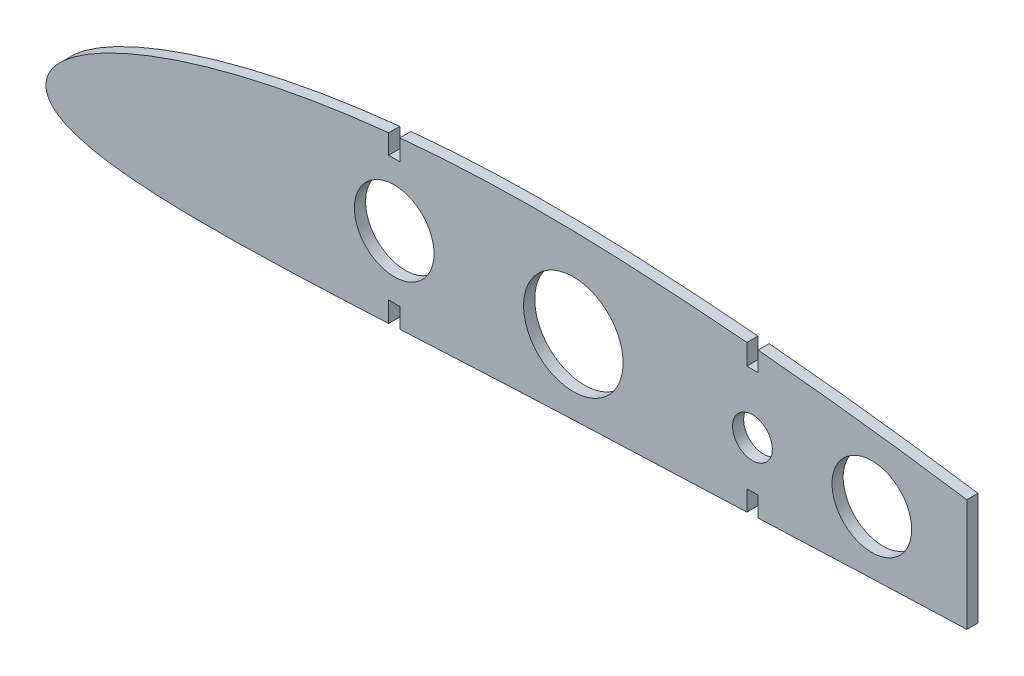
from build123d import *

# Parameters (mm, degrees)
SKETCH_2_R      = 10
SKETCH_2_R_2    = 5
SKETCH_2_R_3    = 12.5
EXTRUDE_1_DEPTH = 1.4


with BuildPart() as part:
    # Эскиз2 → Бобышка-Вытянуть1 (new, symmetric)
    with BuildSketch(Plane.XY):
        with BuildLine():
            Line((86.1, 32.682283633), (86.1, 27.785621096))
            Line((86.1, 27.785621096), (88.9, 27.785621096))
            Line((88.9, 27.785621096), (88.9, 32.962973681))
            add(Edge.make_bspline(
                [(176.1, 32.045532515), (173.460642448, 32.274383054), (167.786299659, 32.738244602), (159.079993996, 33.354548335), (150.013824851, 33.880339702), (141.037533969, 34.297759375), (132.176453799, 34.561309726), (123.418285188, 34.636133951), (114.728660276, 34.522388831), (106.092728827, 34.217419352), (97.485414888, 33.712894632), (91.763569037, 33.237837821), (88.9, 32.962973681)],
                knots=[0.48932836, 0.48932836, 0.48932836, 0.48932836, 0.51130307, 0.536551515, 0.561723366, 0.586628867, 0.611085431, 0.6352512, 0.659272176, 0.683163753, 0.706922144, 0.730783121, 0.730783121, 0.730783121, 0.730783121], degree=3))
            Line((176.1, 32.045532515), (176.1, 26.882916451))
            Line((176.1, 26.882916451), (178.9, 26.882916451))
            Line((178.9, 26.882916451), (178.9, 31.797856127))
            add(Edge.make_bspline(
                [(231.376774993, 25.460683081), (228.623090859, 25.872976705), (222.81618615, 26.717098435), (213.950527179, 27.922839845), (204.785615162, 29.076995056), (195.623903708, 30.135946559), (186.99647265, 31.041402296), (181.421156727, 31.570451189), (178.9, 31.797856127)],
                knots=[0.335389042, 0.335389042, 0.335389042, 0.335389042, 0.358484538, 0.384061186, 0.409602822, 0.435103874, 0.460559416, 0.481556447, 0.481556447, 0.481556447, 0.481556447], degree=3))
            Line((231.376774993, 25.460683081), (231.376774993, -2.762108733))
            add(Edge.make_bspline(
                [(178.9, -4.758637273), (181.652979317, -4.646278606), (187.626173611, -4.403273739), (196.81461857, -4.035333009), (206.460819266, -3.659492142), (216.093643375, -3.297876981), (224.397462902, -3.000330699), (229.490633691, -2.825658562), (231.376774993, -2.762108733)],
                knots=[0.517634386, 0.517634386, 0.517634386, 0.517634386, 0.540928595, 0.568176028, 0.595379569, 0.622543445, 0.64967326, 0.665628529, 0.665628529, 0.665628529, 0.665628529], degree=3))
            Line((178.9, -4.758637273), (178.9, 0.224194977))
            Line((178.9, 0.224194977), (176.1, 0.224194977))
            Line((176.1, 0.224194977), (176.1, -4.873020948))
            add(Edge.make_bspline(
                [(88.9, -8.693267562), (89.617844041, -8.657365264), (93.544099689, -8.4603043), (100.675081793, -8.097607246), (110.279925807, -7.615552634), (119.854698054, -7.155331752), (129.404950626, -6.726934654), (138.957043666, -6.344774315), (148.536329767, -5.989584537), (158.156896352, -5.604325894), (167.348797605, -5.231176131), (173.335752744, -4.986028102), (176.1, -4.873020948)],
                knots=[0.263757046, 0.263757046, 0.263757046, 0.263757046, 0.269833583, 0.296993022, 0.324123272, 0.351139107, 0.378035509, 0.404946016, 0.431960837, 0.459078395, 0.4863474, 0.509737017, 0.509737017, 0.509737017, 0.509737017], degree=3))
            Line((88.9, -8.693267562), (88.9, -3.723116029))
            Line((88.9, -3.723116029), (86.1, -3.723116029))
            Line((86.1, -3.723116029), (86.1, -8.832579685))
            add(Edge.make_bspline(
                [(0.067165, 0.869995), (0.031799348, 0.52288612), (-0.038949105, -0.171499965), (0.109187697, -1.238208426), (0.489573911, -2.294373299), (1.140063589, -3.311096493), (2.048873093, -4.254985343), (3.207362223, -5.125399257), (4.62830025, -5.930091469), (6.349357867, -6.683143801), (8.441643964, -7.39506903), (11.016573701, -8.071443347), (14.236363949, -8.71040323), (18.305613464, -9.295466224), (23.419361508, -9.790139433), (29.665932935, -10.146283203), (36.959978182, -10.327294388), (45.07635799, -10.326759678), (53.756929463, -10.166011212), (62.800670475, -9.879297901), (72.081160335, -9.501034945), (79.871929674, -9.138172062), (84.562006059, -8.908655535), (86.1, -8.832579685)],
                knots=[0, 0, 0, 0, 0.002941446, 0.005884319, 0.00901613, 0.012364547, 0.016007934, 0.020036845, 0.024573728, 0.029783835, 0.03589701, 0.04324044, 0.052275965, 0.063634589, 0.077983176, 0.095698161, 0.116520086, 0.13966073, 0.16431217, 0.18991889, 0.216157201, 0.242837762, 0.255856498, 0.255856498, 0.255856498, 0.255856498], degree=3))
            add(Edge.make_bspline(
                [(86.1, 32.682283633), (84.251034658, 32.488999326), (79.618112888, 31.965003077), (72.248067764, 30.96669173), (64.042160436, 29.619190205), (55.994200632, 28.049519945), (48.157087779, 26.258842728), (40.614534945, 24.258661851), (33.496117772, 22.08061089), (26.978950376, 19.787977208), (21.250737748, 17.476669613), (16.436666106, 15.253855393), (12.543120617, 13.201408311), (9.465247652, 11.352044479), (7.047193647, 9.694493277), (5.140372907, 8.19592153), (3.628941572, 6.819827516), (2.433445936, 5.533634041), (1.497819162, 4.313324923), (0.800303575, 3.138270943), (0.302083458, 2.003099556), (0.143157814, 1.236538372), (0.067165, 0.869995)],
                knots=[0.738563451, 0.738563451, 0.738563451, 0.738563451, 0.7539832, 0.77723469, 0.800246382, 0.822950709, 0.845237155, 0.866915896, 0.887662335, 0.906968281, 0.924203157, 0.938878975, 0.950931611, 0.960693484, 0.968646729, 0.975232933, 0.980794744, 0.985583761, 0.989781539, 0.993521313, 0.996902113, 1, 1, 1, 1], degree=3))
        make_face()
        with Locations((87.5, 12.031252534)):
            Circle(SKETCH_2_R, mode=Mode.SUBTRACT)
        with Locations((177.5, 12.031252534)):
            Circle(SKETCH_2_R_2, mode=Mode.SUBTRACT)
        with Locations((132.5, 12.031252534)):
            Circle(SKETCH_2_R_3, mode=Mode.SUBTRACT)
        with Locations((207.5, 12.031252534)):
            Circle(SKETCH_2_R, mode=Mode.SUBTRACT)
    extrude(amount=EXTRUDE_1_DEPTH, both=True)


solid = part.part
